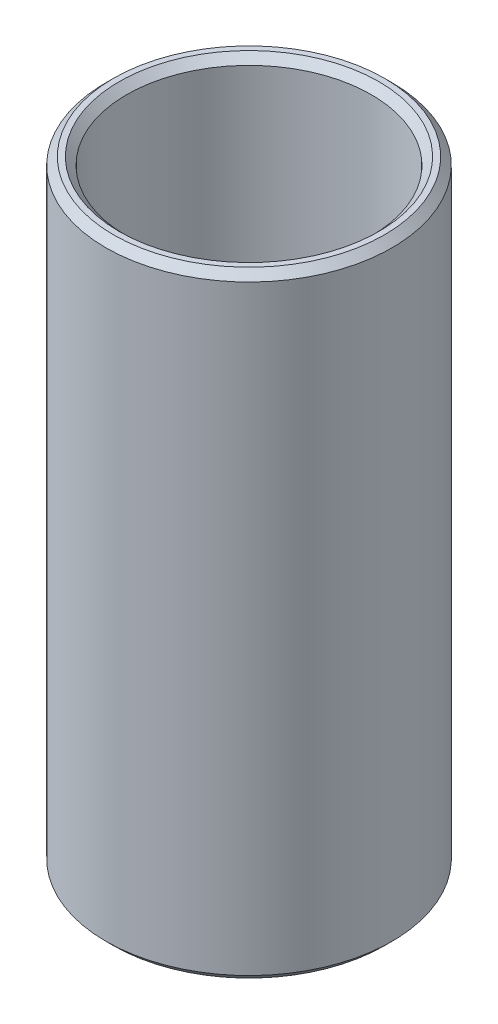
from build123d import *

# Parameters (mm, degrees)
SKETCH1_R           = 57.5
BOSS_EXTRUDE1_DEPTH = 247.437087776
SKETCH2_R           = 49.167628516
CUT_EXTRUDE1_DEPTH  = 261.456546102
CHAMFER1_SIZE       = 3.020726143


with BuildPart() as part:
    # Sketch1 → Boss-Extrude1 (new body)
    with BuildSketch(Plane(origin=(0, 0, 0), x_dir=(1, 0, 0), z_dir=(0, 1, 0))):
        Circle(SKETCH1_R)
    extrude(amount=BOSS_EXTRUDE1_DEPTH)

    # Sketch2 → Cut-Extrude1 (cut, through all)
    with BuildSketch(Plane(origin=(0, 0, 0), x_dir=(1, 0, 0), z_dir=(0, 1, 0))):
        Circle(SKETCH2_R)
    extrude(amount=CUT_EXTRUDE1_DEPTH, mode=Mode.SUBTRACT)

    # Chamfer1
    chamfer1_edges = [part.edges().sort_by_distance(p)[0] for p in [
        (-49.167628516, 247.437087776, 0),
        (-49.167628516, 0, 0),
        (-57.5, 0, 0),
        (-57.5, 247.437087776, 0),
    ]]
    chamfer(chamfer1_edges, length=CHAMFER1_SIZE)


solid = part.part
